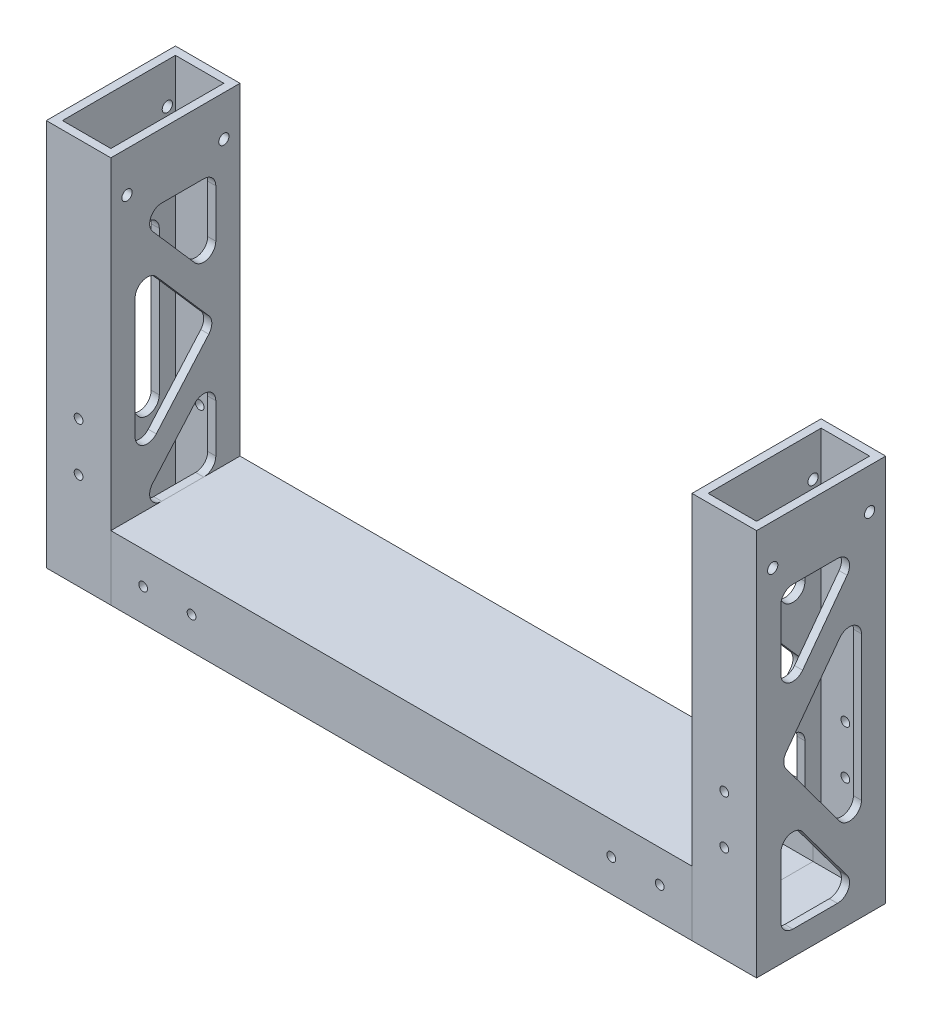
from build123d import *

# Parameters (mm, degrees)
SKETCH2_W                  = 25.4
SKETCH2_H                  = 50.8
SKETCH2_W_2                = 19.05
SKETCH2_H_2                = 44.45
CUT_EXTRUDE1_REACH         = 309.959
CUT_EXTRUDE2_REACH         = 287.114
FILLET1_R                  = 4.7625
F_10_32_TAPPED_HOLE1_D     = 4.0386
F_10_32_TAPPED_HOLE1_DEPTH = 253.999
F_8_32_TAPPED_HOLE1_D      = 3.4544
FILLET1_OF_MIRROR4_R       = 4.7625
SPLIT1_START               = -139.7
SPLIT1_OUTLINE_W           = 152.4
SPLIT1_OUTLINE_H           = 50.8
SPLIT1_OUTLINE_R           = 2.0193
SPLIT1_DEPTH               = 3.175
SPLIT1_START_2             = -117.475
SPLIT1_2_OUTLINE_W         = 152.4
SPLIT1_2_OUTLINE_H         = 50.8
SPLIT1_2_OUTLINE_R         = 2.0193
SPLIT1_2_OUTLINE_W_2       = 19.05
SPLIT1_2_OUTLINE_H_2       = 44.45
SPLIT1_2_DEPTH             = 3.175
SPLIT1_START_3             = -136.525
SPLIT1_3_DEPTH             = 7.7977999
SPLIT1_START_4             = -125.2727999
SPLIT1_4_DEPTH             = 7.7977999
SPLIT1_START_5             = -25.4
SPLIT1_5_DEPTH             = 3.175
SPLIT1_START_6             = 22.225
SPLIT1_6_DEPTH             = 3.175
SPLIT1_START_7             = -22.225
SPLIT1_7_OUTLINE_W         = 3.4544002
SPLIT1_7_OUTLINE_H         = 3.175
SPLIT1_7_DEPTH             = 44.45
SPLIT1_8_OUTLINE_R         = 2.0193
SPLIT1_8_DEPTH             = 279.4
SPLIT1_9_OUTLINE_W         = 25.4
SPLIT1_9_OUTLINE_H         = 50.8
SPLIT1_9_OUTLINE_W_2       = 19.05
SPLIT1_9_OUTLINE_H_2       = 44.45
SPLIT1_9_DEPTH             = 25.4
SPLIT1_START_8             = 114.3
SPLIT1_10_OUTLINE_W        = 25.4
SPLIT1_10_OUTLINE_H        = 50.8
SPLIT1_10_OUTLINE_W_2      = 19.05
SPLIT1_10_OUTLINE_H_2      = 44.45
SPLIT1_10_DEPTH            = 25.4
SPLIT1_START_9             = 136.525
SPLIT1_11_OUTLINE_W        = 152.4
SPLIT1_11_OUTLINE_H        = 50.8
SPLIT1_11_OUTLINE_R        = 2.0193
SPLIT1_11_DEPTH            = 3.175
SPLIT1_12_OUTLINE_W        = 152.4
SPLIT1_12_OUTLINE_H        = 50.8
SPLIT1_12_OUTLINE_W_2      = 19.05
SPLIT1_12_OUTLINE_H_2      = 44.45
SPLIT1_12_OUTLINE_R        = 2.0193
SPLIT1_12_DEPTH            = 3.175
SPLIT1_START_10            = 117.475
SPLIT1_13_DEPTH            = 7.7977999
SPLIT1_START_11            = 128.7272001
SPLIT1_14_DEPTH            = 7.7977999
SPLIT1_15_DEPTH            = 3.175
SPLIT1_16_DEPTH            = 3.175
SPLIT1_17_OUTLINE_W        = 3.4544002
SPLIT1_17_OUTLINE_H        = 3.175
SPLIT1_17_DEPTH            = 44.45


with BuildPart() as part:
    # Sweep1: sweep along a path in Sketch1
    with BuildLine(Plane.XY) as sweep1_path:
        Line((-114.3, 127), (-114.3, 0))
        Line((-114.3, 0), (114.3, 0))
        Line((114.3, 0), (114.3, 127))
    # Sketch2 → Sweep1 (sweep)
    with BuildSketch(Plane(origin=(0, 127, 0), x_dir=(1, 0, 0), z_dir=(0, 1, 0))):
        with Locations((127, 0)):
            Rectangle(SKETCH2_W, SKETCH2_H)
        with Locations((127, 0)):
            Rectangle(SKETCH2_W_2, SKETCH2_H_2, mode=Mode.SUBTRACT)
    sweep(path=sweep1_path.line, transition=Transition.RIGHT)

    # Sketch3 → Cut-Extrude1 (cut, up to next)
    with BuildSketch(Plane(origin=(139.7, 0, 0), x_dir=(0, 0, -1), z_dir=(1, 0, 0)), mode=Mode.PRIVATE) as cut_extrude1_sk1:
        Polygon((-15.875, 101.6), (15.875, 101.6), (-15.875, 58.840068162), align=None)
    cut_extrude1_tool1 = extrude(cut_extrude1_sk1.sketch, amount=-CUT_EXTRUDE1_REACH, mode=Mode.PRIVATE) & part.part
    # Sketch3 → Cut-Extrude1 (cut, up to next)
    with BuildSketch(Plane(origin=(139.7, 0, 0), x_dir=(0, 0, -1), z_dir=(1, 0, 0)), mode=Mode.PRIVATE) as cut_extrude1_sk2:
        Polygon((15.875, 85.622431838), (-15.875, 42.8625), (15.875, 0.102568162), align=None)
    cut_extrude1_tool2 = extrude(cut_extrude1_sk2.sketch, amount=-CUT_EXTRUDE1_REACH, mode=Mode.PRIVATE) & part.part
    # Sketch3 → Cut-Extrude1 (cut, up to next)
    with BuildSketch(Plane(origin=(139.7, 0, 0), x_dir=(0, 0, -1), z_dir=(1, 0, 0)), mode=Mode.PRIVATE) as cut_extrude1_sk3:
        Polygon((-15.875, 26.884931838), (15.875, -15.875), (-15.875, -15.875), align=None)
    cut_extrude1_tool3 = extrude(cut_extrude1_sk3.sketch, amount=-CUT_EXTRUDE1_REACH, mode=Mode.PRIVATE) & part.part
    cut_extrude1_1 = cut_extrude1_tool1.solids().sort_by_distance((139.7, 87.346689, 5.291667))[0]
    add(cut_extrude1_1, mode=Mode.SUBTRACT)
    cut_extrude1_2 = cut_extrude1_tool2.solids().sort_by_distance((139.7, 42.8625, -5.291667))[0]
    add(cut_extrude1_2, mode=Mode.SUBTRACT)
    cut_extrude1_3 = cut_extrude1_tool3.solids().sort_by_distance((139.7, -1.621689, 5.291667))[0]
    add(cut_extrude1_3, mode=Mode.SUBTRACT)
    cut_extrude1 = cut_extrude1_1 + cut_extrude1_2 + cut_extrude1_3  # Cut-Extrude1 as one shape, for the pattern or mirror that repeats it

    # Sketch4 → Cut-Extrude2 (cut, up to next)
    with BuildSketch(Plane.ZY.offset(-114.3), mode=Mode.PRIVATE) as cut_extrude2_sk1:
        Polygon((-15.875, 101.6), (15.875, 101.6), (-15.875, 65.273746208), align=None)
    cut_extrude2_tool1 = extrude(cut_extrude2_sk1.sketch, amount=-CUT_EXTRUDE2_REACH, mode=Mode.PRIVATE) & part.part
    # Sketch4 → Cut-Extrude2 (cut, up to next)
    with BuildSketch(Plane.ZY.offset(-114.3), mode=Mode.PRIVATE) as cut_extrude2_sk2:
        Polygon((15.875, 87.126253792), (-15.875, 50.8), (15.875, 14.473746208), align=None)
    cut_extrude2_tool2 = extrude(cut_extrude2_sk2.sketch, amount=-CUT_EXTRUDE2_REACH, mode=Mode.PRIVATE) & part.part
    # Sketch4 → Cut-Extrude2 (cut, up to next)
    with BuildSketch(Plane.ZY.offset(-114.3), mode=Mode.PRIVATE) as cut_extrude2_sk3:
        Polygon((15.875, 0), (-15.875, 36.326253792), (-15.875, 0), align=None)
    cut_extrude2_tool3 = extrude(cut_extrude2_sk3.sketch, amount=-CUT_EXTRUDE2_REACH, mode=Mode.PRIVATE) & part.part
    cut_extrude2_1 = cut_extrude2_tool1.solids().sort_by_distance((114.3, 89.491249, -5.291667))[0]
    add(cut_extrude2_1, mode=Mode.SUBTRACT)
    cut_extrude2_2 = cut_extrude2_tool2.solids().sort_by_distance((114.3, 50.8, 5.291667))[0]
    add(cut_extrude2_2, mode=Mode.SUBTRACT)
    cut_extrude2_3 = cut_extrude2_tool3.solids().sort_by_distance((114.3, 12.108751, -5.291667))[0]
    add(cut_extrude2_3, mode=Mode.SUBTRACT)
    cut_extrude2 = cut_extrude2_1 + cut_extrude2_2 + cut_extrude2_3  # Cut-Extrude2 as one shape, for the pattern or mirror that repeats it

    # Fillet1
    fillet1_edges = [part.edges().sort_by_distance(p)[0] for p in [
        (138.1125, -15.875, -15.875),
        (138.1125, 26.884931838, 15.875),
        (138.1125, -15.875, 15.875),
        (138.1125, 101.6, -15.875),
        (138.1125, 101.6, 15.875),
        (138.1125, 58.840068162, 15.875),
        (138.1125, 42.8625, 15.875),
        (138.1125, 0.102568162, -15.875),
        (138.1125, 85.622431838, -15.875),
        (115.8875, 0, 15.875),
        (115.8875, 0, -15.875),
        (115.8875, 36.326253792, -15.875),
        (115.8875, 65.273746208, -15.875),
        (115.8875, 101.6, -15.875),
        (115.8875, 101.6, 15.875),
        (115.8875, 87.126253792, 15.875),
        (115.8875, 14.473746208, 15.875),
        (115.8875, 50.8, -15.875),
    ]]
    fillet(fillet1_edges, radius=FILLET1_R)

    # #10-32 Tapped Hole1
    with Locations(Plane(origin=(139.7, 0, 0), x_dir=(0, 0, -1), z_dir=(1, 0, 0))):
        with Locations((-19.05, 111.125), (19.05, 111.125)):
            f_10_32_tapped_hole1 = Hole(F_10_32_TAPPED_HOLE1_D / 2, depth=F_10_32_TAPPED_HOLE1_DEPTH)

    # #8-32 Tapped Hole1 (through all)
    with Locations(Plane.XY.offset(25.4)):
        with Locations((82.55, -12.7), (101.6, -12.7), (127, 12.7), (127, 31.75)):
            f_8_32_tapped_hole1 = Hole(F_8_32_TAPPED_HOLE1_D / 2)

    # Mirror4: Cut-Extrude1, Cut-Extrude2, #10-32 Tapped Hole1, #8-32 Tapped Hole1 across plane
    add(cut_extrude1.mirror(Plane(origin=(0, 0, 0), x_dir=(0, 0, 1), z_dir=(1, 0, 0))), mode=Mode.SUBTRACT)
    add(cut_extrude2.mirror(Plane(origin=(0, 0, 0), x_dir=(0, 0, 1), z_dir=(1, 0, 0))), mode=Mode.SUBTRACT)
    add(f_10_32_tapped_hole1.mirror(Plane(origin=(0, 0, 0), x_dir=(0, 0, 1), z_dir=(1, 0, 0))), mode=Mode.SUBTRACT)
    add(f_8_32_tapped_hole1.mirror(Plane(origin=(0, 0, 0), x_dir=(0, 0, 1), z_dir=(1, 0, 0))), mode=Mode.SUBTRACT)

    # Fillet1 of Mirror4
    fillet1_of_mirror4_edges = [part.edges().sort_by_distance(p)[0] for p in [
        (-138.1125, -15.875, -15.875),
        (-138.1125, 26.884931838, 15.875),
        (-138.1125, -15.875, 15.875),
        (-138.1125, 101.6, -15.875),
        (-138.1125, 101.6, 15.875),
        (-138.1125, 58.840068162, 15.875),
        (-138.1125, 42.8625, 15.875),
        (-138.1125, 0.102568162, -15.875),
        (-138.1125, 85.622431838, -15.875),
        (-115.8875, 0, 15.875),
        (-115.8875, 0, -15.875),
        (-115.8875, 36.326253792, -15.875),
        (-115.8875, 65.273746208, -15.875),
        (-115.8875, 101.6, -15.875),
        (-115.8875, 101.6, 15.875),
        (-115.8875, 87.126253792, 15.875),
        (-115.8875, 14.473746208, 15.875),
        (-115.8875, 50.8, -15.875),
    ]]
    fillet(fillet1_of_mirror4_edges, radius=FILLET1_OF_MIRROR4_R)

    # Split1 8 outline → Split1 8 (cut)
    # profile 1 of 2: a face of its own
    with BuildSketch(Plane.YZ.offset(SPLIT1_START)):
        with BuildLine():
            Line((0, -25.4), (127, -25.4))
            Line((127, -25.4), (127, 25.4))
            Line((127, 25.4), (0, 25.4))
            Line((0, 25.4), (0, 5.38726575))
            ThreePointArc((0, 5.38726575), (2.793357683, 9.723610384), (7.896644529, 8.973146997))
            Line((7.896644529, 8.973146997), (12.348918453, 5.081754895))
            Line((12.348918453, 5.081754895), (0, -4.08753383))
            Line((0, -4.08753383), (0, -25.4))
        make_face()
        with BuildLine():
            Line((23.640442619, -15.875), (14.505342019, -15.875))
            ThreePointArc((14.505342019, -15.875), (9.983631866, -12.607673417), (11.666185769, -7.288810938))
            Line((11.666185769, -7.288810938), (19.687813247, -1.332611723))
            Line((19.687813247, -1.332611723), (26.774587148, -7.526618753))
            ThreePointArc((26.774587148, -7.526618753), (28.0990952, -12.786364811), (23.640442619, -15.875))
        make_face(mode=Mode.SUBTRACT)
        with BuildLine():
            Line((101.6, 5.38726575), (101.6, -6.406947733))
            ThreePointArc((101.6, -6.406947733), (98.977584649, -10.661526907), (93.99834375, -10.230636795))
            Line((93.99834375, -10.230636795), (81.959298862, -1.291434632))
            Line((81.959298862, -1.291434632), (93.703355471, 8.973146997))
            ThreePointArc((93.703355471, 8.973146997), (98.806642317, 9.723610384), (101.6, 5.38726575))
        make_face(mode=Mode.SUBTRACT)
        with BuildLine():
            Line((73.242842019, 15.875), (74.440442619, 15.875))
            ThreePointArc((74.440442619, 15.875), (78.8990952, 12.786364811), (77.574587148, 7.526618753))
            Line((77.574587148, 7.526618753), (74.133704589, 4.519206487))
            Line((74.133704589, 4.519206487), (70.403685769, 7.288810938))
            ThreePointArc((70.403685769, 7.288810938), (68.721131866, 12.607673417), (73.242842019, 15.875))
        make_face(mode=Mode.SUBTRACT)
        with Locations((111.125, 19.05)):
            Circle(SPLIT1_8_OUTLINE_R, mode=Mode.SUBTRACT)
        with Locations((111.125, -19.05)):
            Circle(SPLIT1_8_OUTLINE_R, mode=Mode.SUBTRACT)
        with BuildLine():
            ThreePointArc((74.589607682, -14.477740745), (73.197057382, -11.1125), (74.589607682, -7.747259255))
            ThreePointArc((74.589607682, -7.747259255), (75.982157982, -11.1125), (74.589607682, -14.477740745))
        make_face(mode=Mode.SUBTRACT)
        with BuildLine():
            Line((47.665855471, -13.135683984), (27.51340752, 4.478029395))
            Line((27.51340752, 4.478029395), (40.02334375, 13.766876646))
            ThreePointArc((40.02334375, 13.766876646), (42.8625, 14.705687584), (45.70165625, 13.766876646))
            Line((45.70165625, 13.766876646), (66.794809795, -1.895160132))
            Line((66.794809795, -1.895160132), (53.934144529, -13.135683984))
            ThreePointArc((53.934144529, -13.135683984), (50.8, -14.312302737), (47.665855471, -13.135683984))
        make_face(mode=Mode.SUBTRACT)
    # profile 2 of 2: a face of its own
    with BuildSketch(Plane.YZ.offset(SPLIT1_START)):
        with BuildLine():
            Line((-22.225, -22.225), (-3.175, -22.225))
            Line((-3.175, -22.225), (-3.175, -6.445027064))
            Line((-3.175, -6.445027064), (-8.27334375, -10.230636795))
            ThreePointArc((-8.27334375, -10.230636795), (-13.252584649, -10.661526907), (-15.875, -6.406947733))
            Line((-15.875, -6.406947733), (-15.875, 11.1125))
            ThreePointArc((-15.875, 11.1125), (-14.480096045, 14.480096045), (-11.1125, 15.875))
            Line((-11.1125, 15.875), (-3.175, 15.875))
            Line((-3.175, 15.875), (-3.175, 22.225))
            Line((-3.175, 22.225), (-22.225, 22.225))
            Line((-22.225, 22.225), (-22.225, -22.225))
        make_face()
    extrude(amount=SPLIT1_8_DEPTH, mode=Mode.SUBTRACT)

    # Split1 9 outline → Split1 9 (cut)
    with BuildSketch(Plane.YZ.offset(SPLIT1_START)):
        with Locations((-12.7, 0)):
            Rectangle(SPLIT1_9_OUTLINE_W, SPLIT1_9_OUTLINE_H)
        with Locations((-12.7, 0)):
            Rectangle(SPLIT1_9_OUTLINE_W_2, SPLIT1_9_OUTLINE_H_2, mode=Mode.SUBTRACT)
    extrude(amount=SPLIT1_9_DEPTH, mode=Mode.SUBTRACT)

    # Split1 10 outline → Split1 10 (cut)
    with BuildSketch(Plane.YZ.offset(SPLIT1_START_8)):
        with Locations((-12.7, 0)):
            Rectangle(SPLIT1_10_OUTLINE_W, SPLIT1_10_OUTLINE_H)
        with Locations((-12.7, 0)):
            Rectangle(SPLIT1_10_OUTLINE_W_2, SPLIT1_10_OUTLINE_H_2, mode=Mode.SUBTRACT)
    extrude(amount=SPLIT1_10_DEPTH, mode=Mode.SUBTRACT)


with BuildPart() as body_2:
    # Split1: read off the stored shape, not the designer's step
    # Split1 outline → Split1 (new body)
    with BuildSketch(Plane.YZ.offset(SPLIT1_START)):
        with Locations((50.8, 0)):
            Rectangle(SPLIT1_OUTLINE_W, SPLIT1_OUTLINE_H)
        with BuildLine():
            Line((71.219657981, -15.875), (14.505342019, -15.875))
            ThreePointArc((14.505342019, -15.875), (9.983631866, -12.607673417), (11.666185769, -7.288810938))
            Line((11.666185769, -7.288810938), (40.02334375, 13.766876646))
            ThreePointArc((40.02334375, 13.766876646), (42.8625, 14.705687584), (45.70165625, 13.766876646))
            Line((45.70165625, 13.766876646), (74.058814231, -7.288810938))
            ThreePointArc((74.058814231, -7.288810938), (75.741368134, -12.607673417), (71.219657981, -15.875))
        make_face(mode=Mode.SUBTRACT)
        with BuildLine():
            ThreePointArc((101.6, -6.406947733), (98.977584649, -10.661526907), (93.99834375, -10.230636795))
            Line((93.99834375, -10.230636795), (70.403685769, 7.288810938))
            ThreePointArc((70.403685769, 7.288810938), (68.721131866, 12.607673417), (73.242842019, 15.875))
            Line((73.242842019, 15.875), (96.8375, 15.875))
            ThreePointArc((96.8375, 15.875), (100.205096045, 14.480096045), (101.6, 11.1125))
            Line((101.6, 11.1125), (101.6, -6.406947733))
        make_face(mode=Mode.SUBTRACT)
        with BuildLine():
            Line((15.321314231, 7.288810938), (-8.27334375, -10.230636795))
            ThreePointArc((-8.27334375, -10.230636795), (-13.252584649, -10.661526907), (-15.875, -6.406947733))
            Line((-15.875, -6.406947733), (-15.875, 11.1125))
            ThreePointArc((-15.875, 11.1125), (-14.480096045, 14.480096045), (-11.1125, 15.875))
            Line((-11.1125, 15.875), (12.482157981, 15.875))
            ThreePointArc((12.482157981, 15.875), (17.003868134, 12.607673417), (15.321314231, 7.288810938))
        make_face(mode=Mode.SUBTRACT)
        with Locations((111.125, -19.05)):
            Circle(SPLIT1_OUTLINE_R, mode=Mode.SUBTRACT)
        with Locations((111.125, 19.05)):
            Circle(SPLIT1_OUTLINE_R, mode=Mode.SUBTRACT)
    extrude(amount=SPLIT1_DEPTH)

    # Split1 2 outline → Split1 2 (add)
    with BuildSketch(Plane.YZ.offset(SPLIT1_START_2)):
        with Locations((50.8, 0)):
            Rectangle(SPLIT1_2_OUTLINE_W, SPLIT1_2_OUTLINE_H)
        with BuildLine():
            ThreePointArc((26.774587148, -7.526618753), (28.0990952, -12.786364811), (23.640442619, -15.875))
            Line((23.640442619, -15.875), (4.7625, -15.875))
            ThreePointArc((4.7625, -15.875), (1.394903955, -14.480096045), (0, -11.1125))
            Line((0, -11.1125), (0, 5.38726575))
            ThreePointArc((0, 5.38726575), (2.793357683, 9.723610384), (7.896644529, 8.973146997))
            Line((7.896644529, 8.973146997), (26.774587148, -7.526618753))
        make_face(mode=Mode.SUBTRACT)
        with BuildLine():
            Line((47.665855471, -13.135683984), (24.025412852, 7.526618753))
            ThreePointArc((24.025412852, 7.526618753), (22.7009048, 12.786364811), (27.159557381, 15.875))
            Line((27.159557381, 15.875), (74.440442619, 15.875))
            ThreePointArc((74.440442619, 15.875), (78.8990952, 12.786364811), (77.574587148, 7.526618753))
            Line((77.574587148, 7.526618753), (53.934144529, -13.135683984))
            ThreePointArc((53.934144529, -13.135683984), (50.8, -14.312302737), (47.665855471, -13.135683984))
        make_face(mode=Mode.SUBTRACT)
        with BuildLine():
            Line((74.825412852, -7.526618753), (93.703355471, 8.973146997))
            ThreePointArc((93.703355471, 8.973146997), (98.806642317, 9.723610384), (101.6, 5.38726575))
            Line((101.6, 5.38726575), (101.6, -11.1125))
            ThreePointArc((101.6, -11.1125), (100.205096045, -14.480096045), (96.8375, -15.875))
            Line((96.8375, -15.875), (77.959557381, -15.875))
            ThreePointArc((77.959557381, -15.875), (73.5009048, -12.786364811), (74.825412852, -7.526618753))
        make_face(mode=Mode.SUBTRACT)
        with Locations((111.125, 19.05)):
            Circle(SPLIT1_2_OUTLINE_R, mode=Mode.SUBTRACT)
        with Locations((111.125, -19.05)):
            Circle(SPLIT1_2_OUTLINE_R, mode=Mode.SUBTRACT)
        with Locations((-12.7, 0)):
            Rectangle(SPLIT1_2_OUTLINE_W_2, SPLIT1_2_OUTLINE_H_2, mode=Mode.SUBTRACT)
    extrude(amount=SPLIT1_2_DEPTH)

    # Split1 3 outline → Split1 3 (add)
    with BuildSketch(Plane.YZ.offset(SPLIT1_START_3)):
        Polygon((127, -22.225), (-22.225, -22.225), (-22.225, 22.225), (127, 22.225), (127, 25.4), (-25.4, 25.4), (-25.4, -25.4), (127, -25.4), align=None)
    extrude(amount=SPLIT1_3_DEPTH)

    # Split1 4 outline → Split1 4 (add)
    with BuildSketch(Plane.YZ.offset(SPLIT1_START_4)):
        Polygon((127, -22.225), (-22.225, -22.225), (-22.225, 22.225), (127, 22.225), (127, 25.4), (-25.4, 25.4), (-25.4, -25.4), (127, -25.4), align=None)
    extrude(amount=SPLIT1_4_DEPTH)

    # Split1 5 outline → Split1 5 (add)
    with BuildSketch(Plane.XY.offset(SPLIT1_START_5)):
        with BuildLine():
            ThreePointArc((-125.2728, 12.7), (-127, 10.9728), (-128.7272, 12.7))
            Line((-128.7272, 12.7), (-128.7272001, -25.4))
            Line((-128.7272001, -25.4), (-125.2727999, -25.4))
            Line((-125.2727999, -25.4), (-125.2728, 12.7))
        make_face()
        with BuildLine():
            ThreePointArc((-128.7272, 12.7), (-127, 14.4272), (-125.2728, 12.7))
            Line((-125.2728, 12.7), (-125.2728, 31.75))
            ThreePointArc((-125.2728, 31.75), (-127, 30.0228), (-128.7272, 31.75))
            Line((-128.7272, 31.75), (-128.7272, 12.7))
        make_face()
        with BuildLine():
            ThreePointArc((-128.7272, 31.75), (-127, 33.4772), (-125.2728, 31.75))
            Line((-125.2728, 31.75), (-125.2727999, 127))
            Line((-125.2727999, 127), (-128.7272001, 127))
            Line((-128.7272001, 127), (-128.7272, 31.75))
        make_face()
    extrude(amount=SPLIT1_5_DEPTH)

    # Split1 6 outline → Split1 6 (add)
    with BuildSketch(Plane.XY.offset(SPLIT1_START_6)):
        with BuildLine():
            ThreePointArc((-125.2728, 12.7), (-127, 10.9728), (-128.7272, 12.7))
            Line((-128.7272, 12.7), (-128.7272001, -25.4))
            Line((-128.7272001, -25.4), (-125.2727999, -25.4))
            Line((-125.2727999, -25.4), (-125.2728, 12.7))
        make_face()
        with BuildLine():
            ThreePointArc((-128.7272, 12.7), (-127, 14.4272), (-125.2728, 12.7))
            Line((-125.2728, 12.7), (-125.2728, 31.75))
            ThreePointArc((-125.2728, 31.75), (-127, 30.0228), (-128.7272, 31.75))
            Line((-128.7272, 31.75), (-128.7272, 12.7))
        make_face()
        with BuildLine():
            ThreePointArc((-128.7272, 31.75), (-127, 33.4772), (-125.2728, 31.75))
            Line((-125.2728, 31.75), (-125.2727999, 127))
            Line((-125.2727999, 127), (-128.7272001, 127))
            Line((-128.7272001, 127), (-128.7272, 31.75))
        make_face()
    extrude(amount=SPLIT1_6_DEPTH)

    # Split1 7 outline → Split1 7 (add)
    with BuildSketch(Plane.XY.offset(SPLIT1_START_7)):
        with Locations((-127, -23.8125)):
            Rectangle(SPLIT1_7_OUTLINE_W, SPLIT1_7_OUTLINE_H)
    extrude(amount=SPLIT1_7_DEPTH)


with BuildPart() as body_3:
    # Split1 11 outline → Split1 11 (new body)
    with BuildSketch(Plane.YZ.offset(SPLIT1_START_9)):
        with Locations((50.8, 0)):
            Rectangle(SPLIT1_11_OUTLINE_W, SPLIT1_11_OUTLINE_H)
        with BuildLine():
            ThreePointArc((-8.27334375, -10.230636795), (-13.252584649, -10.661526907), (-15.875, -6.406947733))
            Line((-15.875, -6.406947733), (-15.875, 11.1125))
            ThreePointArc((-15.875, 11.1125), (-14.480096045, 14.480096045), (-11.1125, 15.875))
            Line((-11.1125, 15.875), (12.482157981, 15.875))
            ThreePointArc((12.482157981, 15.875), (17.003868134, 12.607673417), (15.321314231, 7.288810938))
            Line((15.321314231, 7.288810938), (-8.27334375, -10.230636795))
        make_face(mode=Mode.SUBTRACT)
        with BuildLine():
            ThreePointArc((14.505342019, -15.875), (9.983631866, -12.607673417), (11.666185769, -7.288810938))
            Line((11.666185769, -7.288810938), (40.02334375, 13.766876646))
            ThreePointArc((40.02334375, 13.766876646), (42.8625, 14.705687584), (45.70165625, 13.766876646))
            Line((45.70165625, 13.766876646), (74.058814231, -7.288810938))
            ThreePointArc((74.058814231, -7.288810938), (75.741368134, -12.607673417), (71.219657981, -15.875))
            Line((71.219657981, -15.875), (14.505342019, -15.875))
        make_face(mode=Mode.SUBTRACT)
        with BuildLine():
            ThreePointArc((101.6, -6.406947733), (98.977584649, -10.661526907), (93.99834375, -10.230636795))
            Line((93.99834375, -10.230636795), (70.403685769, 7.288810938))
            ThreePointArc((70.403685769, 7.288810938), (68.721131866, 12.607673417), (73.242842019, 15.875))
            Line((73.242842019, 15.875), (96.8375, 15.875))
            ThreePointArc((96.8375, 15.875), (100.205096045, 14.480096045), (101.6, 11.1125))
            Line((101.6, 11.1125), (101.6, -6.406947733))
        make_face(mode=Mode.SUBTRACT)
        with Locations((111.125, -19.05)):
            Circle(SPLIT1_11_OUTLINE_R, mode=Mode.SUBTRACT)
        with Locations((111.125, 19.05)):
            Circle(SPLIT1_11_OUTLINE_R, mode=Mode.SUBTRACT)
    extrude(amount=SPLIT1_11_DEPTH)

    # Split1 12 outline → Split1 12 (add)
    with BuildSketch(Plane.YZ.offset(SPLIT1_START_8)):
        with Locations((50.8, 0)):
            Rectangle(SPLIT1_12_OUTLINE_W, SPLIT1_12_OUTLINE_H)
        with Locations((-12.7, 0)):
            Rectangle(SPLIT1_12_OUTLINE_W_2, SPLIT1_12_OUTLINE_H_2, mode=Mode.SUBTRACT)
        with BuildLine():
            Line((7.896644529, 8.973146997), (26.774587148, -7.526618753))
            ThreePointArc((26.774587148, -7.526618753), (28.0990952, -12.786364811), (23.640442619, -15.875))
            Line((23.640442619, -15.875), (4.7625, -15.875))
            ThreePointArc((4.7625, -15.875), (1.394903955, -14.480096045), (0, -11.1125))
            Line((0, -11.1125), (0, 5.38726575))
            ThreePointArc((0, 5.38726575), (2.793357683, 9.723610384), (7.896644529, 8.973146997))
        make_face(mode=Mode.SUBTRACT)
        with BuildLine():
            ThreePointArc((77.959557381, -15.875), (73.5009048, -12.786364811), (74.825412852, -7.526618753))
            Line((74.825412852, -7.526618753), (93.703355471, 8.973146997))
            ThreePointArc((93.703355471, 8.973146997), (98.806642317, 9.723610384), (101.6, 5.38726575))
            Line((101.6, 5.38726575), (101.6, -11.1125))
            ThreePointArc((101.6, -11.1125), (100.205096045, -14.480096045), (96.8375, -15.875))
            Line((96.8375, -15.875), (77.959557381, -15.875))
        make_face(mode=Mode.SUBTRACT)
        with BuildLine():
            ThreePointArc((74.440442619, 15.875), (78.8990952, 12.786364811), (77.574587148, 7.526618753))
            Line((77.574587148, 7.526618753), (53.934144529, -13.135683984))
            ThreePointArc((53.934144529, -13.135683984), (50.8, -14.312302737), (47.665855471, -13.135683984))
            Line((47.665855471, -13.135683984), (24.025412852, 7.526618753))
            ThreePointArc((24.025412852, 7.526618753), (22.7009048, 12.786364811), (27.159557381, 15.875))
            Line((27.159557381, 15.875), (74.440442619, 15.875))
        make_face(mode=Mode.SUBTRACT)
        with Locations((111.125, -19.05)):
            Circle(SPLIT1_12_OUTLINE_R, mode=Mode.SUBTRACT)
        with Locations((111.125, 19.05)):
            Circle(SPLIT1_12_OUTLINE_R, mode=Mode.SUBTRACT)
    extrude(amount=SPLIT1_12_DEPTH)

    # Split1 13 outline → Split1 13 (add)
    with BuildSketch(Plane.YZ.offset(SPLIT1_START_10)):
        Polygon((127, -22.225), (-22.225, -22.225), (-22.225, 22.225), (127, 22.225), (127, 25.4), (-25.4, 25.4), (-25.4, -25.4), (127, -25.4), align=None)
    extrude(amount=SPLIT1_13_DEPTH)

    # Split1 14 outline → Split1 14 (add)
    with BuildSketch(Plane.YZ.offset(SPLIT1_START_11)):
        Polygon((127, -22.225), (-22.225, -22.225), (-22.225, 22.225), (127, 22.225), (127, 25.4), (-25.4, 25.4), (-25.4, -25.4), (127, -25.4), align=None)
    extrude(amount=SPLIT1_14_DEPTH)

    # Split1 15 outline → Split1 15 (add)
    with BuildSketch(Plane.XY.offset(SPLIT1_START_5)):
        with BuildLine():
            Line((128.7272001, -25.4), (128.7272, 12.7))
            ThreePointArc((128.7272, 12.7), (126.999999924, 10.9728), (125.2728, 12.700000152))
            Line((125.2728, 12.700000152), (125.2727999, -25.4))
            Line((125.2727999, -25.4), (128.7272001, -25.4))
        make_face()
        with BuildLine():
            ThreePointArc((125.2728, 12.700000152), (127.000000076, 14.4272), (128.7272, 12.7))
            Line((128.7272, 12.7), (128.7272, 31.75))
            ThreePointArc((128.7272, 31.75), (127, 30.0228), (125.2728, 31.75))
            Line((125.2728, 31.75), (125.2728, 12.700000152))
        make_face()
        with BuildLine():
            ThreePointArc((125.2728, 31.75), (127, 33.4772), (128.7272, 31.75))
            Line((128.7272, 31.75), (128.7272001, 127))
            Line((128.7272001, 127), (125.2727999, 127))
            Line((125.2727999, 127), (125.2728, 31.75))
        make_face()
    extrude(amount=SPLIT1_15_DEPTH)

    # Split1 16 outline → Split1 16 (add)
    with BuildSketch(Plane.XY.offset(SPLIT1_START_6)):
        with BuildLine():
            Line((128.7272001, -25.4), (128.7272, 12.7))
            ThreePointArc((128.7272, 12.7), (126.999999924, 10.9728), (125.2728, 12.700000152))
            Line((125.2728, 12.700000152), (125.2727999, -25.4))
            Line((125.2727999, -25.4), (128.7272001, -25.4))
        make_face()
        with BuildLine():
            ThreePointArc((125.2728, 12.700000152), (127.000000076, 14.4272), (128.7272, 12.7))
            Line((128.7272, 12.7), (128.7272, 31.75))
            ThreePointArc((128.7272, 31.75), (127, 30.0228), (125.2728, 31.75))
            Line((125.2728, 31.75), (125.2728, 12.700000152))
        make_face()
        with BuildLine():
            ThreePointArc((125.2728, 31.75), (127, 33.4772), (128.7272, 31.75))
            Line((128.7272, 31.75), (128.7272001, 127))
            Line((128.7272001, 127), (125.2727999, 127))
            Line((125.2727999, 127), (125.2728, 31.75))
        make_face()
    extrude(amount=SPLIT1_16_DEPTH)

    # Split1 17 outline → Split1 17 (add)
    with BuildSketch(Plane.XY.offset(SPLIT1_START_7)):
        with Locations((127, -23.8125)):
            Rectangle(SPLIT1_17_OUTLINE_W, SPLIT1_17_OUTLINE_H)
    extrude(amount=SPLIT1_17_DEPTH)


solid = Compound([part.part, body_2.part, body_3.part])
